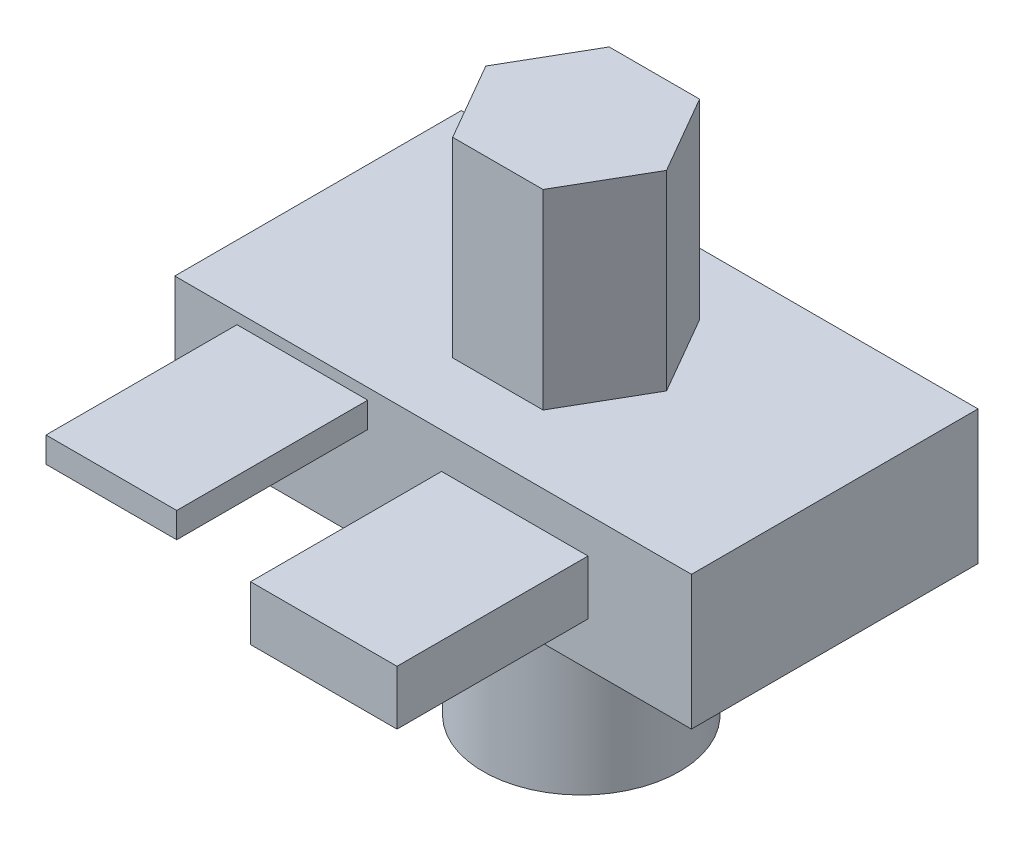
from build123d import *

# Parameters (mm, degrees)
SKETCH1_W           = 137.407001984
SKETCH1_H           = 35.641957088
BOSS_EXTRUDE1_DEPTH = 76.2
BOSS_EXTRUDE2_DEPTH = 50.8
SKETCH3_R           = 26.099786647
BOSS_EXTRUDE3_DEPTH = 50.8
SKETCH4_W           = 34.762618313
SKETCH4_H           = 6.759398006
SKETCH4_W_2         = 38.947007555
SKETCH4_H_2         = 14.484424297
BOSS_EXTRUDE4_DEPTH = 50.8


with BuildPart() as part:
    # Sketch1 → Boss-Extrude1 (new body)
    with BuildSketch(Plane.XY):
        Rectangle(SKETCH1_W, SKETCH1_H)
    extrude(amount=BOSS_EXTRUDE1_DEPTH)

    # Sketch2 → Boss-Extrude2 (add)
    with BuildSketch(Plane(origin=(0, 17.820978544, 0), x_dir=(1, 0, 0), z_dir=(0, 1, 0))):
        Polygon((23.159003861, -37.290679973), (11.143714224, -16.479587852), (-12.886865052, -16.479587852), (-24.90215469, -37.290679973), (-12.886865052, -58.101772093), (11.143714224, -58.101772093), align=None)
    extrude(amount=BOSS_EXTRUDE2_DEPTH)

    # Sketch3 → Boss-Extrude3 (add)
    with BuildSketch(Plane.XZ.offset(17.820978544)):
        with Locations((0, 36.792636879)):
            Circle(SKETCH3_R)
    extrude(amount=BOSS_EXTRUDE3_DEPTH)

    # Sketch4 → Boss-Extrude4 (add)
    with BuildSketch(Plane.XY.offset(76.2)):
        with Locations((-34.762618313, 11.507070414)):
            Rectangle(SKETCH4_W, SKETCH4_H)
        with Locations((21.726636446, 1.04609731)):
            Rectangle(SKETCH4_W_2, SKETCH4_H_2)
    extrude(amount=BOSS_EXTRUDE4_DEPTH)


solid = part.part
